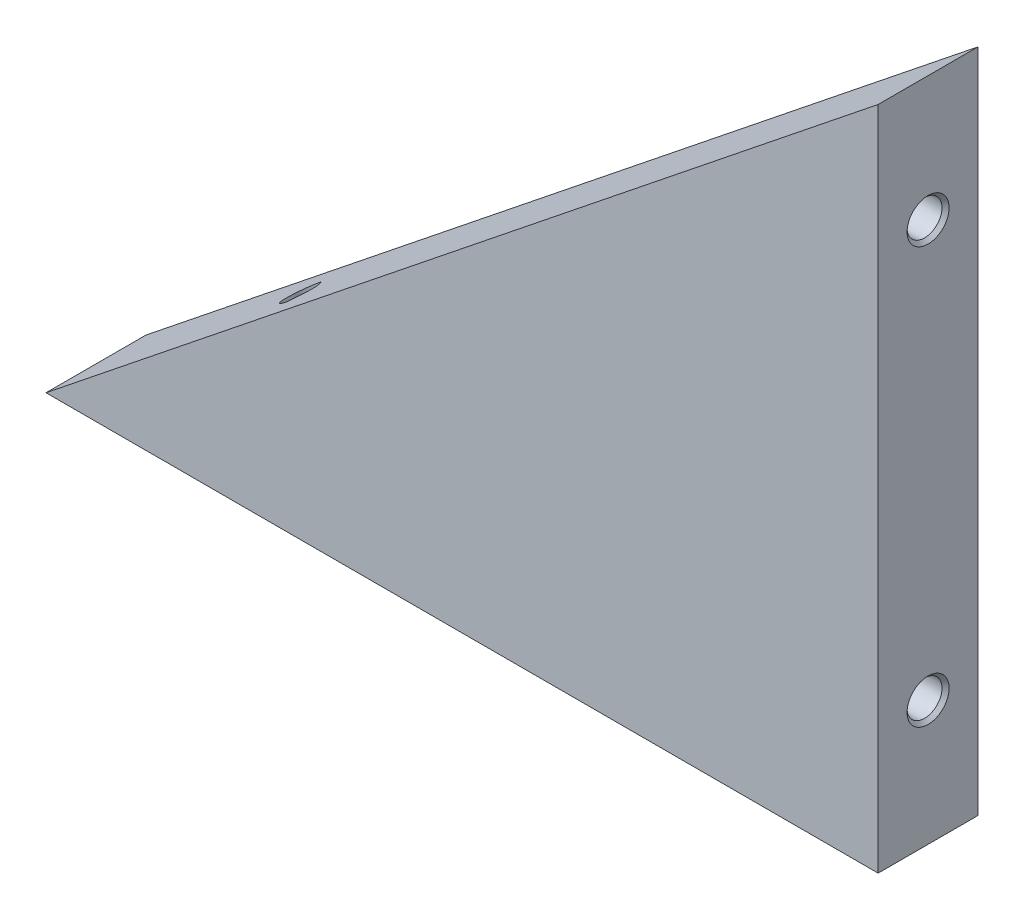
from build123d import *

# Parameters (mm, degrees)
AUFSATZ_LINEAR_AUSTRAGEN1_DEPTH = 12
M5_GEWINDEBOHRUNG2_D            = 4.2
M5_GEWINDEBOHRUNG2_DEPTH        = 15
M5_GEWINDEBOHRUNG2_CSINK_D      = 5.05
M5_GEWINDEBOHRUNG2_CSINK_ANGLE  = 90
M5_GEWINDEBOHRUNG2_TIP          = 1.2618073
M5_GEWINDEBOHRUNG3_D            = 4.2
M5_GEWINDEBOHRUNG3_DEPTH        = 20
M5_GEWINDEBOHRUNG3_CSINK_D      = 5.05
M5_GEWINDEBOHRUNG3_CSINK_ANGLE  = 90
M5_GEWINDEBOHRUNG3_TIP          = 1.2618073


with BuildPart() as part:
    # Skizze1 → Aufsatz-Linear austragen1 (new body)
    with BuildSketch(Plane.XY):
        Polygon((100, 0), (100, 80), (0, 0), align=None)
    extrude(amount=AUFSATZ_LINEAR_AUSTRAGEN1_DEPTH)

    # M5 Gewindebohrung2
    with Locations(Plane(origin=(100, 0, 0), x_dir=(0, 0, -1), z_dir=(1, 0, 0))):
        with Locations((-6, 65), (-6, 15)):
            CounterSinkHole(M5_GEWINDEBOHRUNG2_D / 2, M5_GEWINDEBOHRUNG2_CSINK_D / 2, depth=M5_GEWINDEBOHRUNG2_DEPTH, counter_sink_angle=M5_GEWINDEBOHRUNG2_CSINK_ANGLE)
            with Locations((0, 0, -(M5_GEWINDEBOHRUNG2_DEPTH + M5_GEWINDEBOHRUNG2_TIP / 2))):  # 118° drill point
                Cone(0, M5_GEWINDEBOHRUNG2_D / 2, M5_GEWINDEBOHRUNG2_TIP, mode=Mode.SUBTRACT)

    # M5 Gewindebohrung3
    with Locations(Plane(origin=(0, 0, 0), x_dir=(-1, 0, 0), z_dir=(0, -1, 0))):
        with Locations((-25, -6), (-75, -6)):
            CounterSinkHole(M5_GEWINDEBOHRUNG3_D / 2, M5_GEWINDEBOHRUNG3_CSINK_D / 2, depth=M5_GEWINDEBOHRUNG3_DEPTH, counter_sink_angle=M5_GEWINDEBOHRUNG3_CSINK_ANGLE)
            with Locations((0, 0, -(M5_GEWINDEBOHRUNG3_DEPTH + M5_GEWINDEBOHRUNG3_TIP / 2))):  # 118° drill point
                Cone(0, M5_GEWINDEBOHRUNG3_D / 2, M5_GEWINDEBOHRUNG3_TIP, mode=Mode.SUBTRACT)


solid = part.part
